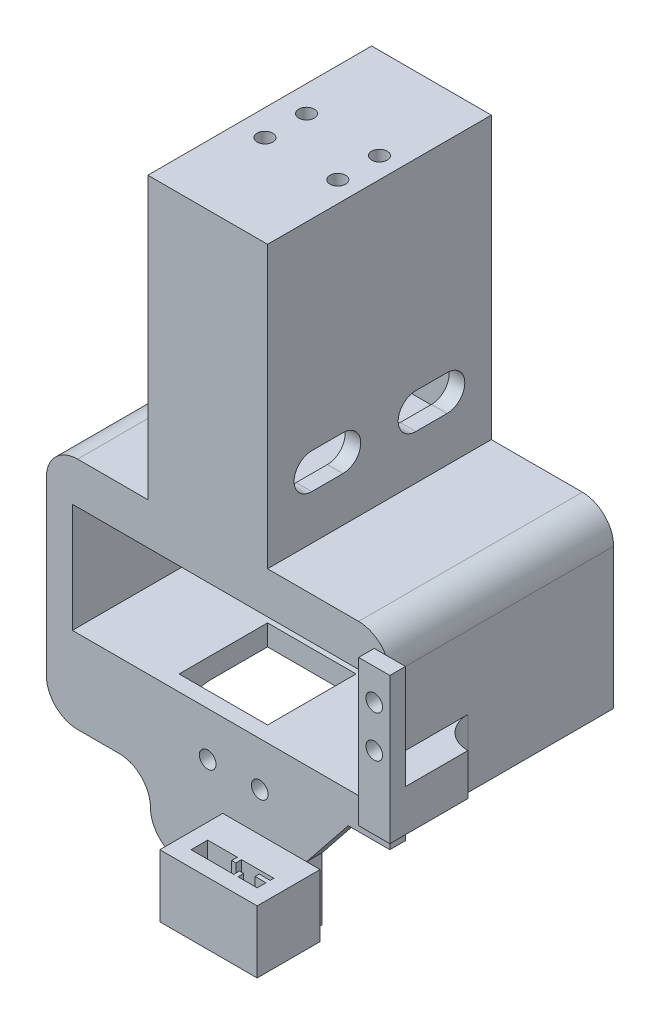
from build123d import *

# Parameters (mm, degrees)
SKETCH_2_W           = 17
SKETCH_2_H           = 17
EXTRUDE_1_DEPTH      = 47
SHELL_2_T            = 3
SKETCH_8_R           = 1.6
SKETCH_8_W           = 56
SKETCH_8_H           = 21
EXTRUDE_2_DEPTH      = 3
SKETCH_9_W           = 66
SKETCH_9_H           = 4
EXTRUDE_3_DEPTH      = 40
SKETCH_11_W          = 13
SKETCH_11_H          = 13
CUT_EXTRUDE_3_DEPTH  = 3
EXTRUDE_START        = -48
SKETCH_13_W          = 17
SKETCH_13_H          = 17
EXTRUDE_4_DEPTH      = 3
SKETCH_17_W          = 17
SKETCH_17_H          = 17
CUT_EXTRUDE_4_DEPTH  = 78.409624725
SKETCH_19_W          = 30
SKETCH_19_H          = 12
EXTRUDE_8_DEPTH      = 3
SKETCH_20_W          = 0.8
SKETCH_20_H          = 1.1
SKETCH_20_W_2        = 2.1
SKETCH_20_H_2        = 0.8
EXTRUDE_9_DEPTH      = 12
FILLET_5_R           = 6
EXTRUDE_11_DEPTH     = 20
EXTRUDE_START_2      = 3
SKETCH_23_W          = 6
SKETCH_23_H          = 28
SKETCH_23_R          = 1.6
EXTRUDE_12_DEPTH     = 3
EXTRUDE_START_3      = -28
SKETCH_24_W          = 6
SKETCH_24_H          = 12
EXTRUDE_13_DEPTH     = 8
FILLET_START         = -40
FILLET_6_DEPTH       = 43
FILLET_START_2       = -6
FILLET_6_2_DEPTH     = 9
FILLET_START_3       = -33
FILLET_6_3_DEPTH     = 13
FILLET_START_4       = -11
FILLET_6_4_DEPTH     = 11
EXTRUDE_START_4      = 12
EXTRUDE_14_DEPTH     = 12
SKETCH_26_W          = 17
SKETCH_26_H          = 29
CUT_EXTRUDE_6_DEPTH  = 50
SKETCH_29_W          = 35
SKETCH_29_H          = 4
EXTRUDE_15_DEPTH     = 23
SKETCH_30_W          = 23
SKETCH_30_H          = 35
EXTRUDE_16_DEPTH     = 10
EXTRUDE_START_5      = 8
EXTRUDE_17_DEPTH     = 8
CUT_EXTRUDE_10_DEPTH = 82.579715616
SKETCH_33_W          = 17
SKETCH_33_H          = 37
CUT_EXTRUDE_11_DEPTH = 44
SKETCH_35_W          = 17
SKETCH_35_H          = 37
EXTRUDE_18_DEPTH     = 3
SKETCH_31_R          = 1.5
CUT_EXTRUDE_13_DEPTH = 5
SKETCH_39_R          = 1.5
CUT_EXTRUDE_14_DEPTH = 1.5


with BuildPart() as part:
    # 草图2 → 凸台-拉伸1 (new body)
    with BuildSketch(Plane(origin=(0, 0, 0), x_dir=(1, 0, 0), z_dir=(0, 1, 0))):
        with Locations((8.5, 8.5)):
            Rectangle(SKETCH_2_W, SKETCH_2_H)
    extrude(amount=EXTRUDE_1_DEPTH)

    # 抽壳2
    shell_2_openings = [part.faces().sort_by_distance(p)[0] for p in [
        (8.5, 0, -8.5),
    ]]
    offset(amount=SHELL_2_T, openings=shell_2_openings, kind=Kind.INTERSECTION)

    # 草图8 → 凸台-拉伸2 (add)
    with BuildSketch(Plane.XY.offset(3)):
        Polygon((-22.5, 0), (43.5, 0), (43.5, -35), (35.5, -35), (27.5, -45), (-22.5, -45), align=None)
        with Locations((8.5, -37.5)):
            Circle(SKETCH_8_R, mode=Mode.SUBTRACT)
        with Locations((18.5, -37.5)):
            Circle(SKETCH_8_R, mode=Mode.SUBTRACT)
        with Locations((10.5, -18.5)):
            Rectangle(SKETCH_8_W, SKETCH_8_H, mode=Mode.SUBTRACT)
    extrude(amount=-EXTRUDE_2_DEPTH)

    # 草图9 → 凸台-拉伸3 (add)
    with BuildSketch(Plane(origin=(0, 0, 0), x_dir=(-1, 0, 0), z_dir=(0, 0, -1))):
        with Locations((-10.5, -31)):
            Rectangle(SKETCH_9_W, SKETCH_9_H)
    extrude(amount=EXTRUDE_3_DEPTH)

    # 草图11 → 切除-拉伸3 (cut)
    with BuildSketch(Plane(origin=(0, 50, 0), x_dir=(1, 0, 0), z_dir=(0, 1, 0))):
        with Locations((8.5, 8.5)):
            Rectangle(SKETCH_11_W, SKETCH_11_H)
    extrude(amount=-CUT_EXTRUDE_3_DEPTH, mode=Mode.SUBTRACT)

    # 草图13 → 凸台-拉伸4 (add)
    with BuildSketch(Plane(origin=(0, 50, 0), x_dir=(1, 0, 0), z_dir=(0, 1, 0)).offset(EXTRUDE_START)):
        with Locations((8.5, 8.5)):
            Rectangle(SKETCH_13_W, SKETCH_13_H)
    extrude(amount=EXTRUDE_4_DEPTH)

    # 草图17 → 切除-拉伸4 (cut, through all)
    with BuildSketch(Plane(origin=(0, 5, 0), x_dir=(1, 0, 0), z_dir=(0, 1, 0))):
        with Locations((8.5, 8.5)):
            Rectangle(SKETCH_17_W, SKETCH_17_H)
    extrude(amount=-CUT_EXTRUDE_4_DEPTH, mode=Mode.SUBTRACT)

    # 草图19 → 凸台-拉伸8 (add)
    with BuildSketch(Plane.XY.offset(3)):
        with Locations((12.5, -51)):
            Rectangle(SKETCH_19_W, SKETCH_19_H)
    extrude(amount=-EXTRUDE_8_DEPTH)

    # 草图20 → 凸台-拉伸9 (add)
    # profile 1 of 4: a face of its own
    with BuildSketch(Plane.XZ.offset(57)):
        Polygon((27.5, 3), (30.1, 3), (30.1, 15.1), (11.4, 15.1), (11.4, 3), align=None)
        Polygon((14.4, 8.9), (14.4, 12.1), (22.6, 12.1), (23.4, 12.1), (27.1, 12.1), (27.1, 10.4), (27.1, 9.6), (27.1, 8.9), (20.9, 8.9), (20.1, 8.9), align=None, mode=Mode.SUBTRACT)
    # profile 2 of 4: a face of its own
    with BuildSketch(Plane.XZ.offset(57)):
        with Locations((23, 11.55)):
            Rectangle(SKETCH_20_W, SKETCH_20_H)
    # profile 3 of 4: a face of its own
    with BuildSketch(Plane.XZ.offset(57)):
        with Locations((20.5, 9.45)):
            Rectangle(SKETCH_20_W, SKETCH_20_H)
    # profile 4 of 4: a face of its own
    with BuildSketch(Plane.XZ.offset(57)):
        with Locations((26.05, 10)):
            Rectangle(SKETCH_20_W_2, SKETCH_20_H_2)
    extrude(amount=-EXTRUDE_9_DEPTH)

    # 圆角5
    fillet_5_edges = [part.edges().sort_by_distance(p)[0] for p in [
        (-11.25, -33, 0),
        (-22.5, -45, 1.5),
        (-2.5, -57, 1.5),
        (-2.5, -45, 1.5),
    ]]
    fillet(fillet_5_edges, radius=FILLET_5_R - 0.0001)  # a hair under: the kernel refuses the full size

    # 草图22 → 凸台-拉伸11 (add)
    with BuildSketch(Plane(origin=(0, 0, 0), x_dir=(-1, 0, 0), z_dir=(0, 0, -1))):
        Polygon((0, 0), (-17, 0), (-20, 0), (-43.5, 0), (-43.5, -29), (-38.5, -29), (-38.5, -8), (17.5, -8), (17.5, -29), (22.5, -29), (22.5, 0), (3, 0), align=None)
    extrude(amount=EXTRUDE_11_DEPTH)



with BuildPart() as body_2:
    # 草图23 → 凸台-拉伸12 (new body)
    with BuildSketch(Plane.XY.offset(3).offset(EXTRUDE_START_2)):
        with Locations((46.5, -14)):
            Rectangle(SKETCH_23_W, SKETCH_23_H)
        with Locations((46.5, -6)):
            Circle(SKETCH_23_R, mode=Mode.SUBTRACT)
        with Locations((46.5, -14)):
            Circle(SKETCH_23_R, mode=Mode.SUBTRACT)
    extrude(amount=EXTRUDE_12_DEPTH)


with BuildPart() as part_1:
    add(part.part)

    add(body_2.part)  # 凸台-拉伸13 merges body 2
    # 草图24 → 凸台-拉伸13 (add)
    with BuildSketch(Plane(origin=(0, 0, 0), x_dir=(1, 0, 0), z_dir=(0, 1, 0)).offset(EXTRUDE_START_3)):
        with Locations((46.5, 0)):
            Rectangle(SKETCH_24_W, SKETCH_24_H)
    extrude(amount=EXTRUDE_13_DEPTH)

    # 圆角6: read off the stored shape, not the designer's step
    # 圆角6 outline → 圆角6 (cut)
    with BuildSketch(Plane.XY.offset(FILLET_START)):
        with BuildLine():
            ThreePointArc((37.5, 0), (41.742640687, -1.757359313), (43.5, -6))
            Line((43.5, -6), (43.5, 0))
            Line((43.5, 0), (37.5, 0))
        make_face()
        with BuildLine():
            Line((-22.5, 0), (-22.5, -6))
            ThreePointArc((-22.5, -6), (-20.742640687, -1.757359313), (-16.5, 0))
            Line((-16.5, 0), (-22.5, 0))
        make_face()
    extrude(amount=FILLET_6_DEPTH, mode=Mode.SUBTRACT)

    # Fillet 6 2 outline → Fillet 6 2 (add)
    with BuildSketch(Plane.XY.offset(FILLET_START_2)):
        with BuildLine():
            Line((43.5, -28), (43.5, -34))
            ThreePointArc((43.5, -34), (45.257359313, -29.757359313), (49.5, -28))
            Line((49.5, -28), (43.5, -28))
        make_face()
    extrude(amount=FILLET_6_2_DEPTH)

    # Fillet 6 3 outline → Fillet 6 3 (add)
    with BuildSketch(Plane(origin=(0, 0, 0), x_dir=(1, 0, 0), z_dir=(0, 1, 0)).offset(FILLET_START_3)):
        with BuildLine():
            ThreePointArc((49.5, 6), (45.257359313, 7.757359313), (43.5, 12))
            Line((43.5, 12), (43.5, 6))
            Line((43.5, 6), (49.5, 6))
        make_face()
    extrude(amount=FILLET_6_3_DEPTH)

    # Fillet 6 4 outline → Fillet 6 4 (cut)
    with BuildSketch(Plane.XY.offset(FILLET_START_4)):
        with BuildLine():
            ThreePointArc((49.5, -28), (45.627016654, -29.417424305), (43.583920217, -33))
            Line((43.583920217, -33), (49.5, -33))
            Line((49.5, -33), (49.5, -28))
        make_face()
        with BuildLine():
            ThreePointArc((43.5, -34), (43.521016863, -33.498242438), (43.583920217, -33))
            Line((43.583920217, -33), (43.5, -33))
            Line((43.5, -33), (43.5, -34))
        make_face()
    extrude(amount=FILLET_6_4_DEPTH, mode=Mode.SUBTRACT)

    # 草图25 → 凸台-拉伸14 (add)
    with BuildSketch(Plane(origin=(0, 0, -20), x_dir=(-1, 0, 0), z_dir=(0, 0, -1)).offset(EXTRUDE_START_4)):
        with BuildLine():
            Line((22.5, -29), (22.5, -6))
            ThreePointArc((22.5, -6), (20.742640687, -1.757359313), (16.5, 0))
            Line((16.5, 0), (3, 0))
            Line((3, 0), (3, 50))
            Line((3, 50), (-20, 50))
            Line((-20, 50), (-20, 0))
            Line((-20, 0), (-37.5, 0))
            ThreePointArc((-37.5, 0), (-41.742640687, -1.757359313), (-43.5, -6))
            Line((-43.5, -6), (-43.5, -29))
            Line((-43.5, -29), (-38.5, -29))
            Line((-38.5, -29), (-38.5, -8))
            Line((-38.5, -8), (17.5, -8))
            Line((17.5, -8), (17.5, -29))
            Line((17.5, -29), (22.5, -29))
        make_face()
    extrude(amount=-EXTRUDE_14_DEPTH)

    # 草图26 → 切除-拉伸6 (cut)
    with BuildSketch(Plane(origin=(0, 50, 0), x_dir=(1, 0, 0), z_dir=(0, 1, 0))):
        with Locations((8.5, 14.5)):
            Rectangle(SKETCH_26_W, SKETCH_26_H)
    extrude(amount=-CUT_EXTRUDE_6_DEPTH, mode=Mode.SUBTRACT)

    # 草图29 → 凸台-拉伸15 (add)
    with BuildSketch(Plane(origin=(20, 0, 0), x_dir=(0, 0, -1), z_dir=(1, 0, 0))):
        with Locations((14.5, 52)):
            Rectangle(SKETCH_29_W, SKETCH_29_H)
    extrude(amount=-EXTRUDE_15_DEPTH)

    # 草图30 → 凸台-拉伸16 (add)
    with BuildSketch(Plane(origin=(0, 54, 0), x_dir=(1, 0, 0), z_dir=(0, 1, 0))):
        with Locations((8.5, 14.5)):
            Rectangle(SKETCH_30_W, SKETCH_30_H)
    extrude(amount=-EXTRUDE_16_DEPTH)

    # 草图32 → 凸台-拉伸17 (add)
    with BuildSketch(Plane(origin=(0, 0, -32), x_dir=(-1, 0, 0), z_dir=(0, 0, -1)).offset(EXTRUDE_START_5)):
        with BuildLine():
            Line((-20, 0), (-37.5, 0))
            ThreePointArc((-37.5, 0), (-41.742640687, -1.757359313), (-43.5, -6))
            Line((-43.5, -6), (-43.5, -29))
            Line((-43.5, -29), (-38.5, -29))
            Line((-38.5, -29), (-38.5, -8))
            Line((-38.5, -8), (17.5, -8))
            Line((17.5, -8), (17.5, -29))
            Line((17.5, -29), (22.5, -29))
            Line((22.5, -29), (22.5, -6))
            ThreePointArc((22.5, -6), (20.742640687, -1.757359313), (16.5, 0))
            Line((16.5, 0), (3, 0))
            Line((3, 0), (3, 54))
            Line((3, 54), (-20, 54))
            Line((-20, 54), (-20, 0))
        make_face()
    extrude(amount=-EXTRUDE_17_DEPTH)

    # 草图34 → 切除-拉伸10 (cut, through all)
    with BuildSketch(Plane(origin=(20, 0, 0), x_dir=(0, 0, -1), z_dir=(1, 0, 0))):
        with BuildLine():
            Line((5.5, 15.4), (11.5, 15.4))
            ThreePointArc((11.5, 15.4), (14.9, 12), (11.5, 8.6))
            Line((11.5, 8.6), (5.5, 8.6))
            ThreePointArc((5.5, 8.6), (2.1, 12), (5.5, 15.4))
        make_face()
        with BuildLine():
            Line((25.5, 15.4), (31.5, 15.4))
            ThreePointArc((31.5, 15.4), (34.9, 12), (31.5, 8.6))
            Line((31.5, 8.6), (25.5, 8.6))
            ThreePointArc((25.5, 8.6), (22.1, 12), (25.5, 15.4))
        make_face()
    extrude(amount=-CUT_EXTRUDE_10_DEPTH, mode=Mode.SUBTRACT)

    # 草图33 → 切除-拉伸11 (cut)
    with BuildSketch(Plane(origin=(0, 0, 0), x_dir=(1, 0, 0), z_dir=(0, 1, 0))):
        with Locations((8.5, 18.5)):
            Rectangle(SKETCH_33_W, SKETCH_33_H)
    extrude(amount=CUT_EXTRUDE_11_DEPTH, mode=Mode.SUBTRACT)

    # 草图35 → 凸台-拉伸18 (add)
    with BuildSketch(Plane(origin=(0, 0, 0), x_dir=(1, 0, 0), z_dir=(0, 1, 0))):
        with Locations((8.5, 18.5)):
            Rectangle(SKETCH_35_W, SKETCH_35_H)
    extrude(amount=EXTRUDE_18_DEPTH)

    # 草图31 → 切除-拉伸13 (cut)
    with BuildSketch(Plane(origin=(0, 54, 0), x_dir=(1, 0, 0), z_dir=(0, 1, 0))):
        with Locations(Location((2, 22.5, 0), (0, 0, 270))):
            Circle(SKETCH_31_R)
        with Locations(Location((2, 14.5, 0), (0, 0, 270))):
            Circle(SKETCH_31_R)
        with Locations(Location((16, 22.5, 0), (0, 0, 270))):
            Circle(SKETCH_31_R)
        with Locations(Location((16, 14.5, 0), (0, 0, 270))):
            Circle(SKETCH_31_R)
    extrude(amount=-CUT_EXTRUDE_13_DEPTH, mode=Mode.SUBTRACT)

    # 草图39 → 切除-拉伸14 (cut)
    with BuildSketch(Plane(origin=(0, 49, 0), x_dir=(1, 0, 0), z_dir=(0, 1, 0))):
        with Locations(Location((2, 14.5, 0), (0, 0, 270))):
            Circle(SKETCH_39_R)
        with Locations(Location((16, 22.5, 0), (0, 0, 270))):
            Circle(SKETCH_39_R)
    extrude(amount=-CUT_EXTRUDE_14_DEPTH, mode=Mode.SUBTRACT)


solid = part_1.part
